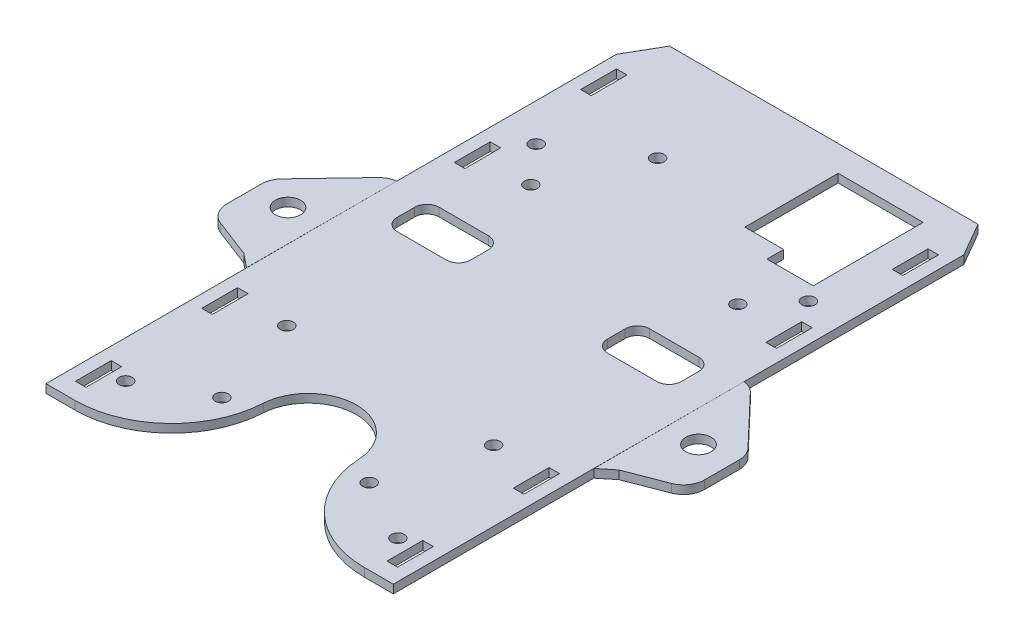
from build123d import *

# Parameters (mm, degrees)
SKETCH1_W                   = 2.5
SKETCH1_H                   = 8.5
SKETCH1_R                   = 1.55
EXTRUDE_2777_DEPTH          = 2
SKETCH_3030_R               = 3
EXTRUDE_1_DEPTH             = 2
EXTRUDE_1_2_DEPTH           = 2
CUT_EXTRUDE_4639_DEPTH      = 106.13740862
CUT_EXTRUDE_4639_DEPTH_BACK = 106.13740862
FILLET_1_R                  = 5
FILLET_2_R                  = 5


with BuildPart() as part:
    # Sketch1 → Extrude 2777 (new body)
    with BuildSketch(Plane(origin=(0, 0, 0), x_dir=(1, 0, 0), z_dir=(0, 1, 0))):
        with BuildLine():
            Line((-41.25, 0), (-41.25, -55))
            Line((-41.25, -55), (-34.369560329, -55))
            ThreePointArc((-34.369560329, -55), (-18.59120626, -48.721265785), (-11.440696816, -33.31837076))
            ThreePointArc((-11.440696816, -33.31837076), (-7.872843983, -25.632867641), (0, -22.5))
            ThreePointArc((0, -22.5), (7.872843983, -25.632867641), (11.440696816, -33.31837076))
            ThreePointArc((11.440696816, -33.31837076), (18.59120626, -48.721265785), (34.369560329, -55))
            Line((34.369560329, -55), (41.25, -55))
            Line((41.25, -55), (41.25, 0))
            Line((41.25, 0), (41.25, 80.5))
            Line((41.25, 80.5), (36.640789302, 88.483387111))
            Line((36.640789302, 88.483387111), (-36.640789302, 88.483387111))
            Line((-36.640789302, 88.483387111), (-41.25, 80.5))
            Line((-41.25, 80.5), (-41.25, 0))
        make_face()
        with Locations((-37, -46.75)):
            Rectangle(SKETCH1_W, SKETCH1_H, mode=Mode.SUBTRACT)
        with Locations(Location((-32.325, -45, 0), (0, 0, 270))):
            Circle(SKETCH1_R, mode=Mode.SUBTRACT)
        with Locations(Location((-17.5, -36.97765453, 0), (0, 0, 270))):
            Circle(SKETCH1_R, mode=Mode.SUBTRACT)
        with Locations((-37, -16.75)):
            Rectangle(SKETCH1_W, SKETCH1_H, mode=Mode.SUBTRACT)
        with Locations(Location((-24.575, -14.5, 0), (0, 0, 270))):
            Circle(SKETCH1_R, mode=Mode.SUBTRACT)
        with Locations(Location((17.5, -36.97765453, 0), (0, 0, 270))):
            Circle(SKETCH1_R, mode=Mode.SUBTRACT)
        with Locations((37, -46.75)):
            Rectangle(SKETCH1_W, SKETCH1_H, mode=Mode.SUBTRACT)
        with Locations(Location((32.325, -45, 0), (0, 0, 270))):
            Circle(SKETCH1_R, mode=Mode.SUBTRACT)
        with Locations(Location((24.575, -14.5, 0), (0, 0, 270))):
            Circle(SKETCH1_R, mode=Mode.SUBTRACT)
        with Locations((37, -16.75)):
            Rectangle(SKETCH1_W, SKETCH1_H, mode=Mode.SUBTRACT)
        with Locations((-37, 43.25)):
            Rectangle(SKETCH1_W, SKETCH1_H, mode=Mode.SUBTRACT)
        with Locations(Location((-32.325, 52.5, 0), (0, 0, 270))):
            Circle(SKETCH1_R, mode=Mode.SUBTRACT)
        with Locations(Location((-24.575, 43.5, 0), (0, 0, 270))):
            Circle(SKETCH1_R, mode=Mode.SUBTRACT)
        with Locations((-37, 73.25)):
            Rectangle(SKETCH1_W, SKETCH1_H, mode=Mode.SUBTRACT)
        with Locations(Location((-15.000000144, 64.02234547, 0), (0, 0, 270))):
            Circle(SKETCH1_R, mode=Mode.SUBTRACT)
        with Locations(Location((24.575, 43.5, 0), (0, 0, 270))):
            Circle(SKETCH1_R, mode=Mode.SUBTRACT)
        with Locations((37, 43.25)):
            Rectangle(SKETCH1_W, SKETCH1_H, mode=Mode.SUBTRACT)
        with Locations(Location((32.325, 52.5, 0), (0, 0, 270))):
            Circle(SKETCH1_R, mode=Mode.SUBTRACT)
        Polygon((9.55, 60.2), (9.55, 82.35), (29.75, 82.35), (29.75, 56.25), (18.75, 56.25), (18.75, 60.2), align=None, mode=Mode.SUBTRACT)
        with Locations((37, 73.25)):
            Rectangle(SKETCH1_W, SKETCH1_H, mode=Mode.SUBTRACT)
    extrude(amount=EXTRUDE_2777_DEPTH)

    # 底部天线接口<3> → Cut-Extrude 4639 (cut, two sides: drawn at the far end of the back side and taken through both)
    with BuildSketch(Plane(origin=(0, 0, 0), x_dir=(1, 0, 0), z_dir=(0, 1, 0)).offset(-CUT_EXTRUDE_4639_DEPTH_BACK)):
        with BuildLine():
            Line((-30.85, 17.980435299), (-19.15, 17.980435299))
            ThreePointArc((-19.15, 17.980435299), (-17.099390335, 18.829825634), (-16.25, 20.880435299))
            Line((-16.25, 20.880435299), (-16.25, 25.080435299))
            ThreePointArc((-16.25, 25.080435299), (-17.099390335, 27.131044965), (-19.15, 27.980435299))
            Line((-19.15, 27.980435299), (-30.85, 27.980435299))
            ThreePointArc((-30.85, 27.980435299), (-32.900609665, 27.131044965), (-33.75, 25.080435299))
            Line((-33.75, 25.080435299), (-33.75, 20.880435299))
            ThreePointArc((-33.75, 20.880435299), (-32.900609665, 18.829825634), (-30.85, 17.980435299))
        make_face()
        with BuildLine():
            Line((30.85, 27.980435299), (19.15, 27.980435299))
            ThreePointArc((19.15, 27.980435299), (17.099390335, 27.131044965), (16.25, 25.080435299))
            Line((16.25, 25.080435299), (16.25, 20.880435299))
            ThreePointArc((16.25, 20.880435299), (17.099390335, 18.829825634), (19.15, 17.980435299))
            Line((19.15, 17.980435299), (30.85, 17.980435299))
            ThreePointArc((30.85, 17.980435299), (32.900609665, 18.829825634), (33.75, 20.880435299))
            Line((33.75, 20.880435299), (33.75, 25.080435299))
            ThreePointArc((33.75, 25.080435299), (32.900609665, 27.131044965), (30.85, 27.980435299))
        make_face()
    extrude(amount=CUT_EXTRUDE_4639_DEPTH + CUT_EXTRUDE_4639_DEPTH_BACK, mode=Mode.SUBTRACT)


with BuildPart() as body_2:
    # Sketch 3030 → 天线接口-1 (new body)
    with BuildSketch(Plane(origin=(0, 0, 0), x_dir=(1, 0, 0), z_dir=(0, 1, 0))):
        Polygon((-44.551087495, -4.702300511), (-41.285942601, -7.350545872), (-41.25, 28.319513771), (-42.804455524, 28.319513771), (-56.750021115, 13.670703557), (-56.750021115, 0), align=None)
        with Locations(Location((-48.750021115, 9.980435299, 0), (0, 0, 270))):
            Circle(SKETCH_3030_R, mode=Mode.SUBTRACT)
    extrude(amount=EXTRUDE_1_DEPTH)

    # 圆角1
    # the kernel refuses this fillet: 5 mm, written as the material it takes off along each edge
    with BuildSketch(Plane(origin=(-56.750021115, -8.578159327, 0), x_dir=(0, 0, -1), z_dir=(0, 1, 0))) as fillet_1_piece_1:
        with BuildLine():
            CenterArc((FILLET_1_R * 0.686252746169, -FILLET_1_R), FILLET_1_R, 90, 68.919937097)
            Line((-FILLET_1_R * 0.246825999537, -FILLET_1_R * 0.640327851633), (-FILLET_1_R * 0.265487574451, -FILLET_1_R * 0.633134408666))
            Line((-FILLET_1_R * 0.265487574451, -FILLET_1_R * 0.633134408666), (-FILLET_1_R * 0.0137250549234, FILLET_1_R * 0.02))
            Line((-FILLET_1_R * 0.0137250549234, FILLET_1_R * 0.02), (FILLET_1_R * 0.686252746169, FILLET_1_R * 0.02))
            Line((FILLET_1_R * 0.686252746169, FILLET_1_R * 0.02), (FILLET_1_R * 0.686252746169, 0))
        make_face()
    extrude(amount=19.156318654, mode=Mode.SUBTRACT)
    with BuildSketch(Plane(origin=(-56.750021115, -4.998525097, -13.670703557), x_dir=(0.6895078371932688, 0, -0.7242782217139079), z_dir=(0, 1, 0))) as fillet_1_piece_2:
        with BuildLine():
            CenterArc((FILLET_1_R * 0.399882007735, -FILLET_1_R), FILLET_1_R, 90, 43.591162535)
            Line((-FILLET_1_R * 0.289625829458, -FILLET_1_R * 0.275721778286), (-FILLET_1_R * 0.303415986202, -FILLET_1_R * 0.261236213852))
            Line((-FILLET_1_R * 0.303415986202, -FILLET_1_R * 0.261236213852), (-FILLET_1_R * 0.00799764015471, FILLET_1_R * 0.02))
            Line((-FILLET_1_R * 0.00799764015471, FILLET_1_R * 0.02), (FILLET_1_R * 0.399882007735, FILLET_1_R * 0.02))
            Line((FILLET_1_R * 0.399882007735, FILLET_1_R * 0.02), (FILLET_1_R * 0.399882007735, 0))
        make_face()
    extrude(amount=11.997050193, mode=Mode.SUBTRACT)
    with BuildSketch(Plane(origin=(-42.804455524, -5.222622885, -28.319513771), x_dir=(1, 0, 0), z_dir=(0, 1, 0))) as fillet_1_piece_3:
        with BuildLine():
            CenterArc((2.180975345, -4.960591992), FILLET_1_R, 97.198309661, 39.210527804)
            Line((-1.440415764, -1.513052806), (-1.512843586, -1.444102023))
            Line((-1.512843586, -1.444102023), (-0.072427822, 0.068950784))
            Line((-0.072427822, 0.068950784), (0, 0.1))
            ThreePointArc((0, 0.1), (0.777227762, 0.1), (1.541925127, 0.09921184))
            Line((1.541925127, 0.09921184), (1.554455524, 0))
        make_face()
    extrude(amount=12.44524577, mode=Mode.SUBTRACT)


with BuildPart() as body_3:
    # Sketch 3030 → Extrude 1 2 (new body)
    with BuildSketch(Plane(origin=(0, 0, 0), x_dir=(1, 0, 0), z_dir=(0, 1, 0))):
        Polygon((42.804455524, 28.319513771), (56.750021115, 13.670703557), (56.750021115, 0), (44.551087495, -4.702300511), (41.285942601, -7.350545872), (41.25, 28.319513771), align=None)
        with Locations(Location((48.750021115, 9.980435299, 0), (0, 0, 270))):
            Circle(SKETCH_3030_R, mode=Mode.SUBTRACT)
    extrude(amount=EXTRUDE_1_2_DEPTH)

    # 圆角2
    # the kernel refuses this fillet: 5 mm, written as the material it takes off along each edge
    with BuildSketch(Plane(origin=(56.750021115, -8.578159327, 0), x_dir=(0, 0, -1), z_dir=(0, 1, 0))) as fillet_2_piece_1:
        with BuildLine():
            CenterArc((FILLET_2_R * 0.686252746169, FILLET_2_R), FILLET_2_R, 201.080062903, 68.919937097)
            Line((-FILLET_2_R * 0.246825999537, FILLET_2_R * 0.640327851633), (-FILLET_2_R * 0.265487574451, FILLET_2_R * 0.633134408666))
            Line((-FILLET_2_R * 0.265487574451, FILLET_2_R * 0.633134408666), (-FILLET_2_R * 0.0137250549234, -FILLET_2_R * 0.02))
            Line((-FILLET_2_R * 0.0137250549234, -FILLET_2_R * 0.02), (FILLET_2_R * 0.686252746169, -FILLET_2_R * 0.02))
            Line((FILLET_2_R * 0.686252746169, -FILLET_2_R * 0.02), (FILLET_2_R * 0.686252746169, 0))
        make_face()
    extrude(amount=19.156318654, mode=Mode.SUBTRACT)
    with BuildSketch(Plane(origin=(56.750021115, -4.998525097, -13.670703557), x_dir=(-0.6895078371932707, 0, -0.724278221713906), z_dir=(0, 1, 0))) as fillet_2_piece_2:
        with BuildLine():
            CenterArc((FILLET_2_R * 0.399882007735, FILLET_2_R), FILLET_2_R, 226.408837465, 43.591162535)
            Line((-FILLET_2_R * 0.289625829458, FILLET_2_R * 0.275721778286), (-FILLET_2_R * 0.303415986202, FILLET_2_R * 0.261236213852))
            Line((-FILLET_2_R * 0.303415986202, FILLET_2_R * 0.261236213852), (-FILLET_2_R * 0.00799764015471, -FILLET_2_R * 0.02))
            Line((-FILLET_2_R * 0.00799764015471, -FILLET_2_R * 0.02), (FILLET_2_R * 0.399882007735, -FILLET_2_R * 0.02))
            Line((FILLET_2_R * 0.399882007735, -FILLET_2_R * 0.02), (FILLET_2_R * 0.399882007735, 0))
        make_face()
    extrude(amount=11.997050193, mode=Mode.SUBTRACT)
    with BuildSketch(Plane(origin=(42.804455524, -5.222622885, -28.319513771), x_dir=(0.6895078371932738, 0, 0.7242782217139031), z_dir=(0, 1, 0))) as fillet_2_piece_3:
        with BuildLine():
            CenterArc((2.089049154, -5), FILLET_2_R, 90, 39.210527804)
            Line((-1.071809266, -1.125858282), (-1.135026435, -1.048375448))
            ThreePointArc((-1.135026435, -1.048375448), (-0.608332455, -0.493978358), (-0.072427822, 0.068950784))
            Line((-0.072427822, 0.068950784), (0, 0.1))
            Line((0, 0.1), (2.089049154, 0.1))
            Line((2.089049154, 0.1), (2.089049154, 0))
        make_face()
    extrude(amount=12.44524577, mode=Mode.SUBTRACT)


solid = Compound([part.part, body_2.part, body_3.part])
